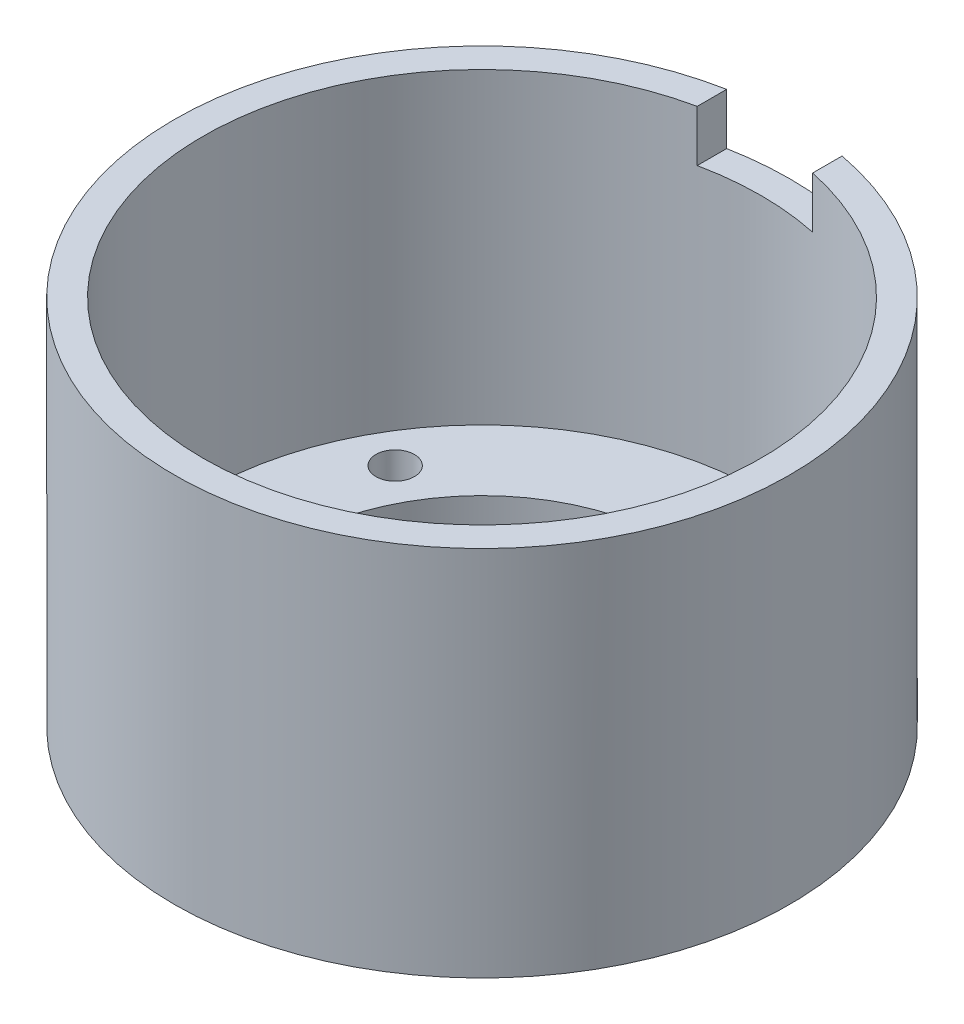
from build123d import *

# Parameters (mm, degrees)
SKETCH1_R               = 24
SKETCH1_R_2             = 21.75
BOSS_EXTRUDE1_DEPTH     = 24
BOSS_EXTRUDE2_START     = 5
SKETCH2_R               = 24
SKETCH2_R_2             = 15
BOSS_EXTRUDE2_DEPTH     = 5
SKETCH3_R               = 2.5
CUT_EXTRUDE1_DEPTH      = 2
SKETCH4_R               = 1.5
CUT_EXTRUDE2_DEPTH      = 44.370496884
CUT_EXTRUDE3_REACH      = 60.788
CUT_EXTRUDE3_END_RADIUS = 21.75
SKETCH5_W               = 9
SKETCH5_H               = 4


with BuildPart() as part:
    # Sketch1 → Boss-Extrude1 (new body)
    with BuildSketch(Plane(origin=(0, 0, 0), x_dir=(1, 0, 0), z_dir=(0, 1, 0))):
        Circle(SKETCH1_R)
        Circle(SKETCH1_R_2, mode=Mode.SUBTRACT)
    extrude(amount=BOSS_EXTRUDE1_DEPTH)

    # Sketch2 → Boss-Extrude2 (add)
    with BuildSketch(Plane.XZ.offset(BOSS_EXTRUDE2_START)):
        Circle(SKETCH2_R)
        Circle(SKETCH2_R_2, mode=Mode.SUBTRACT)
    extrude(amount=-BOSS_EXTRUDE2_DEPTH)

    # Sketch3 → Cut-Extrude1 (cut)
    with BuildSketch(Plane.XZ.offset(5)):
        with Locations((0, 18.5)):
            Circle(SKETCH3_R)
        with Locations((16.02146997, -9.25)):
            Circle(SKETCH3_R)
        with Locations((-16.02146997, -9.25)):
            Circle(SKETCH3_R)
    extrude(amount=-CUT_EXTRUDE1_DEPTH, mode=Mode.SUBTRACT)

    # Sketch4 → Cut-Extrude2 (cut, through all)
    with BuildSketch(Plane.XZ.offset(3)):
        with Locations((0, 18.5)):
            Circle(SKETCH4_R)
        with Locations((16.02146997, -9.25)):
            Circle(SKETCH4_R)
        with Locations((-16.02146997, -9.25)):
            Circle(SKETCH4_R)
    extrude(amount=-CUT_EXTRUDE2_DEPTH, mode=Mode.SUBTRACT)

    # Cut-Extrude3: up to this cylinder (the profile starts outside it)
    cut_extrude3_end = Plane(origin=(0, 22, 0), z_dir=(0, -1, 0)) * Cylinder(CUT_EXTRUDE3_END_RADIUS, 166.076, mode=Mode.PRIVATE)
    # Sketch5 → Cut-Extrude3 (cut, up to the surface)
    with BuildSketch(Plane(origin=(0, 0, -24), x_dir=(-1, 0, 0), z_dir=(0, 0, -1)), mode=Mode.PRIVATE) as cut_extrude3_sk1:
        with Locations((0, 22)):
            Rectangle(SKETCH5_W, SKETCH5_H)
    cut_extrude3_tool1 = extrude(cut_extrude3_sk1.sketch, amount=-CUT_EXTRUDE3_REACH, mode=Mode.PRIVATE) - cut_extrude3_end
    add(cut_extrude3_tool1.solids().sort_by_distance((0, 22, -24))[0], mode=Mode.SUBTRACT)


solid = part.part
